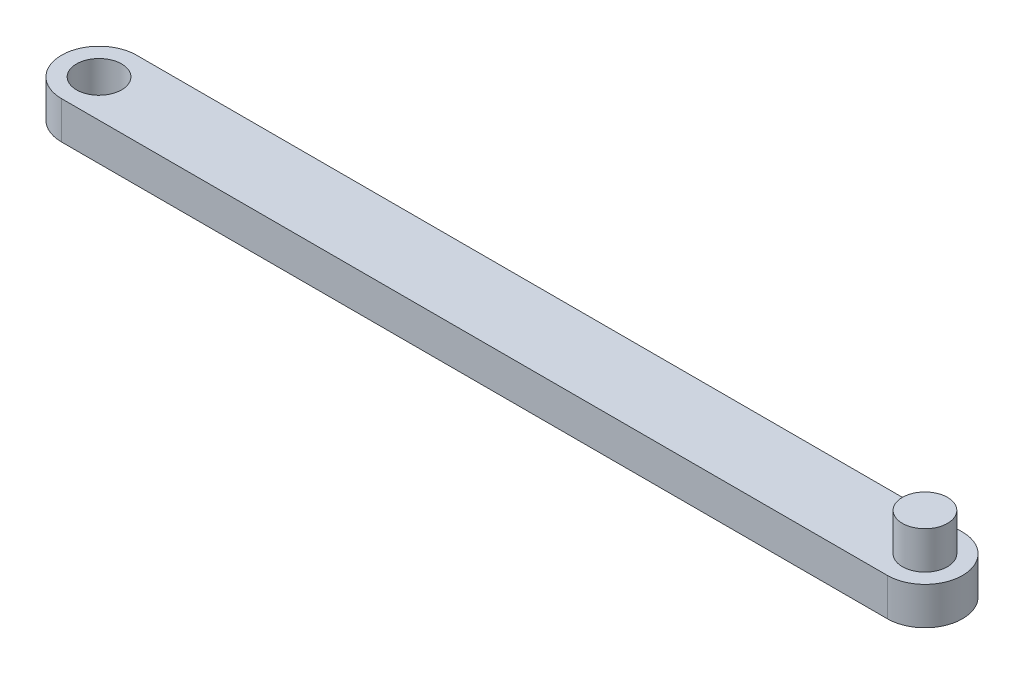
from build123d import *

# Parameters (mm, degrees)
SKETCH_1_R      = 3
EXTRUDE_1_DEPTH = 5
SKETCH_2_R      = 3
EXTRUDE_2_DEPTH = 5


with BuildPart() as part:
    # 草图1 → 凸台-拉伸1 (new body)
    with BuildSketch(Plane(origin=(0, 0, 0), x_dir=(1, 0, 0), z_dir=(0, 1, 0))):
        with BuildLine():
            Line((0, 0), (109.9, 0))
            ThreePointArc((109.9, 0), (114.9, -5), (109.9, -10))
            Line((109.9, -10), (0, -10))
            ThreePointArc((0, -10), (-5, -5), (0, 0))
        make_face()
        with Locations((0, -5)):
            Circle(SKETCH_1_R, mode=Mode.SUBTRACT)
    extrude(amount=EXTRUDE_1_DEPTH)

    # 草图2 → 凸台-拉伸2 (add)
    with BuildSketch(Plane(origin=(0, 5, 0), x_dir=(1, 0, 0), z_dir=(0, 1, 0))):
        with Locations((109.9, -5)):
            Circle(SKETCH_2_R)
    extrude(amount=EXTRUDE_2_DEPTH)


solid = part.part
